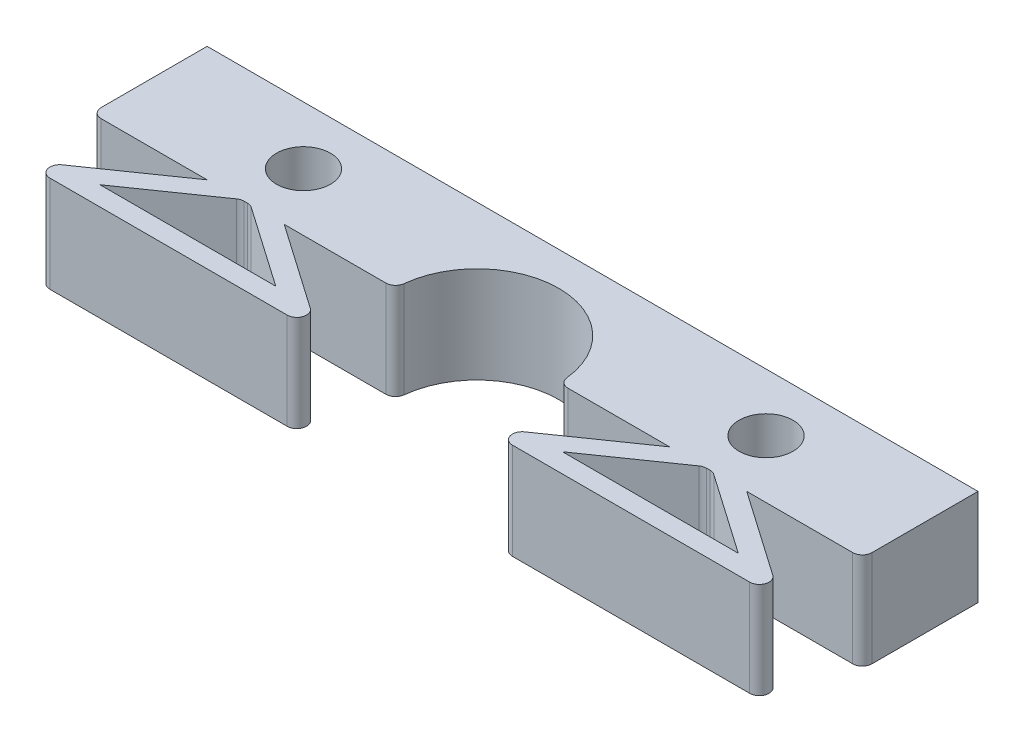
from build123d import *

# Parameters (mm, degrees)
SKETCH1_R           = 1.4
BOSS_EXTRUDE1_DEPTH = 5
CUT_EXTRUDE1_DEPTH  = 22.470910554
FILLET1_R           = 0.5


with BuildPart() as part:
    # Sketch1 → Boss-Extrude1 (new body)
    with BuildSketch(Plane(origin=(0, 0, 0), x_dir=(1, 0, 0), z_dir=(0, 1, 0))):
        Polygon((-20, 6), (20, 6), (20, 0), (14, 0), (19.75, -4), (4.25, -4), (10, 0), (-10, 0), (-4.25, -4), (-19.75, -4), (-14, 0), (-20, 0), align=None)
        with Locations((12, 3)):
            Circle(SKETCH1_R, mode=Mode.SUBTRACT)
        with Locations((-12, 3)):
            Circle(SKETCH1_R, mode=Mode.SUBTRACT)
        Polygon((12.248884284, 0), (11.751115716, 0), (7.438615716, -3), (16.561384284, -3), align=None, mode=Mode.SUBTRACT)
        Polygon((-12.248884284, 0), (-11.751115716, 0), (-7.438615716, -3), (-16.561384284, -3), align=None, mode=Mode.SUBTRACT)
    extrude(amount=BOSS_EXTRUDE1_DEPTH)

    # Sketch2 → Cut-Extrude1 (cut, through all)
    with BuildSketch(Plane(origin=(0, 5, 0), x_dir=(1, 0, 0), z_dir=(0, 1, 0))):
        with BuildLine():
            Line((-4.25, 0), (4.25, 0))
            ThreePointArc((4.25, 0), (0, 4.25), (-4.25, 0))
        make_face()
    extrude(amount=-CUT_EXTRUDE1_DEPTH, mode=Mode.SUBTRACT)

    # Fillet1
    fillet1_edges = [part.edges().sort_by_distance(p)[0] for p in [
        (19.75, 2.5, 4),
        (4.25, 2.5, 4),
        (-4.25, 2.5, 4),
        (-19.75, 2.5, 4),
        (20, 2.5, 0),
        (4.25, 2.5, 0),
        (-4.25, 2.5, 0),
        (-20, 2.5, 0),
        (-11.751115716, 2.5, 0),
        (-12.248884284, 2.5, 0),
        (12.248884284, 2.5, 0),
        (11.751115716, 2.5, 0),
    ]]
    fillet(fillet1_edges, radius=FILLET1_R)


solid = part.part
